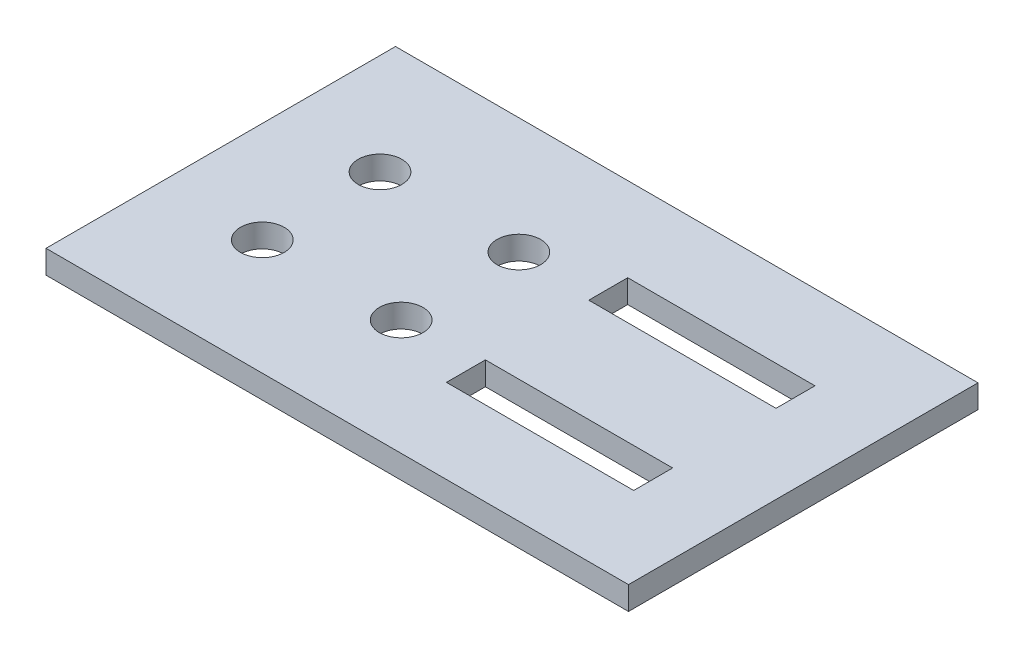
from build123d import *

# Parameters (mm, degrees)
SKETCH1_W                    = 127
SKETCH1_H                    = 76.2
BOSS_EXTRUDE1_DEPTH          = 5.08
F_3_8_0_375_DIAMETER_HOLE1_D = 9.525
SKETCH8_W                    = 40.825215383
SKETCH8_H                    = 8.493240981
CUT_EXTRUDE2_DEPTH           = 66.04


with BuildPart() as part:
    # Sketch1 → Boss-Extrude1 (new body)
    with BuildSketch(Plane(origin=(0, 0, 0), x_dir=(1, 0, 0), z_dir=(0, 1, 0))):
        Rectangle(SKETCH1_W, SKETCH1_H)
    extrude(amount=BOSS_EXTRUDE1_DEPTH)

    # 3/8 (0.375) Diameter Hole1 (through all)
    with Locations(Plane(origin=(0, 5.08, 0), x_dir=(-1, 0, 0), z_dir=(0, 1, 0))):
        with Locations((41.514204045, -12.737661128), (41.514204045, 12.925310348), (11.242749375, 12.925310348), (11.242749375, -12.737661128)):
            Hole(F_3_8_0_375_DIAMETER_HOLE1_D / 2)

    # Sketch8 → Cut-Extrude2 (cut)
    with BuildSketch(Plane(origin=(0, 5.08, 0), x_dir=(1, 0, 0), z_dir=(0, 1, 0))):
        with Locations((25.880700264, -15.514339236)):
            Rectangle(SKETCH8_W, SKETCH8_H)
        with Locations((25.880700264, 15.514339236)):
            Rectangle(SKETCH8_W, SKETCH8_H)
    extrude(amount=-CUT_EXTRUDE2_DEPTH, mode=Mode.SUBTRACT)


solid = part.part
